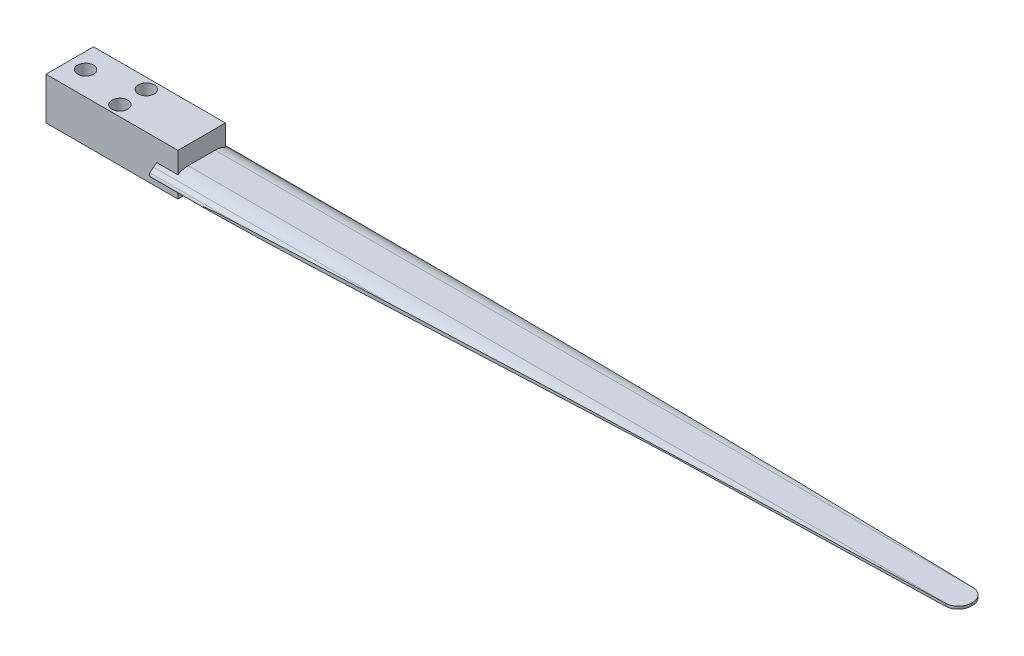
from build123d import *

# Parameters (mm, degrees)
BOSS_EXTRUDE1_DEPTH      = 1500
FILLET1_R                = 40
FILLET2_R                = 40
FILLET3_R                = 5
FILLET4_R                = 5
CUT_EXTRUDE1_DEPTH       = 1502.3316039943886
CUT_EXTRUDE1_DEPTH_BACK  = 1502.3316039943886
FILLET5_R                = 25
BOSS_EXTRUDE2_DEPTH      = 35
BOSS_EXTRUDE2_DEPTH_BACK = 45
SKETCH3_R                = 15.000000000000025
SKETCH3_R_2              = 14.999999999999998


with BuildPart() as part:
    # Sketch1 → Boss-Extrude1 (new body)
    with BuildSketch(Plane(origin=(0, 0, 0), x_dir=(0, 0, -1), z_dir=(1, 0, 0))):
        Polygon((0, 0), (40, 0), (61.94779998780638, -18.416390874921095), (58.733861939373675, -22.246613090515982), (38.18014882866898, -5), (0, -5), (-38.18014882866898, -5), (-58.733861939373675, -22.246613090515982), (-61.94779998780638, -18.416390874921095), (-40, 0), align=None)
    extrude(amount=BOSS_EXTRUDE1_DEPTH)

    # Fillet1
    fillet1_edges = [part.edges().sort_by_distance(p)[0] for p in [
        (750, -5, -38.18014882866898),
        (750, 0, 40),
    ]]
    fillet(fillet1_edges, radius=FILLET1_R)

    # Fillet2
    fillet2_edges = [part.edges().sort_by_distance(p)[0] for p in [
        (750, 0, -40),
    ]]
    fillet(fillet2_edges, radius=FILLET2_R)

    # Fillet3
    # the kernel refuses this fillet: 5 mm, written as the material it takes off along each edge
    with BuildSketch(Plane(origin=(0, -8.840835335933875, -69.98264510888814), x_dir=(0, 0.6427876096865403, 0.7660444431189772), z_dir=(0, -0.7660444431189772, 0.6427876096865403))) as fillet3_piece_1:
        with BuildLine():
            CenterArc((FILLET3_R, -FILLET3_R), FILLET3_R, 90, 90)
            Line((-2.28e-15, -FILLET3_R), (0, 0))
            Line((0, 0), (FILLET3_R, 0))
        make_face()
    extrude(amount=30.000000000000007, mode=Mode.SUBTRACT)
    with BuildSketch(Plane(origin=(-12.500000000000002, -18.4163908749211, -61.94779998780638), x_dir=(0, 0.6427876096865406, 0.7660444431189771), z_dir=(1, 0, 0))) as fillet3_piece_2:
        with BuildLine():
            CenterArc((FILLET3_R, FILLET3_R), FILLET3_R, 180, 90)
            Line((1.03e-15, FILLET3_R), (0, 0))
            Line((0, 0), (FILLET3_R, 2.8e-16))
        make_face()
    extrude(amount=1525, mode=Mode.SUBTRACT)
    with BuildSketch(Plane(origin=(-12.500000000000002, -22.246613090515982, -58.733861939373675), x_dir=(0, 0.7660444431189772, -0.6427876096865403), z_dir=(1, 0, 0))) as fillet3_piece_3:
        with BuildLine():
            CenterArc((FILLET3_R, FILLET3_R), FILLET3_R, 180, 90)
            Line((1.1e-16, FILLET3_R), (0, 0))
            Line((0, 0), (FILLET3_R, -6e-17))
        make_face()
    extrude(amount=1525, mode=Mode.SUBTRACT)
    with BuildSketch(Plane(origin=(1500, -8.840835335933875, -69.98264510888814), x_dir=(0, 0.6427876096865403, 0.7660444431189772), z_dir=(0, -0.7660444431189772, 0.6427876096865403))) as fillet3_piece_4:
        with BuildLine():
            CenterArc((FILLET3_R, FILLET3_R), FILLET3_R, 180, 90)
            Line((-2.28e-15, FILLET3_R), (0, 0))
            Line((0, 0), (FILLET3_R, 0))
        make_face()
    extrude(amount=30.000000000000007, mode=Mode.SUBTRACT)

    # Fillet4
    # the kernel refuses this fillet: 5 mm, written as the material it takes off along each edge
    with BuildSketch(Plane(origin=(0, -31.822168629503203, 50.69901681829192), x_dir=(0, 0.6427876096865403, -0.7660444431189772), z_dir=(0, 0.7660444431189772, 0.6427876096865403))) as fillet4_piece_1:
        with BuildLine():
            CenterArc((FILLET4_R, -FILLET4_R), FILLET4_R, 90, 90)
            Line((0, -FILLET4_R), (0, 0))
            Line((0, 0), (FILLET4_R, 0))
        make_face()
    extrude(amount=30.000000000000007, mode=Mode.SUBTRACT)
    with BuildSketch(Plane(origin=(-12.500000000000007, -22.246613090515982, 58.733861939373675), x_dir=(0, 0.7660444431189776, 0.6427876096865399), z_dir=(1, 0, 0))) as fillet4_piece_2:
        with BuildLine():
            CenterArc((FILLET4_R, -FILLET4_R), FILLET4_R, 90.00000000000004, 90)
            Line((5.38e-15, -FILLET4_R), (0, 0))
            Line((0, 0), (FILLET4_R, 2.4e-16))
        make_face()
    extrude(amount=1525, mode=Mode.SUBTRACT)
    with BuildSketch(Plane(origin=(-12.500000000000002, -18.416390874921095, 61.94779998780638), x_dir=(0, 0.6427876096865403, -0.7660444431189772), z_dir=(1, 0, 0))) as fillet4_piece_3:
        with BuildLine():
            CenterArc((FILLET4_R, -FILLET4_R), FILLET4_R, 90, 89.99999999999997)
            Line((2.28e-15, -FILLET4_R), (0, 0))
            Line((0, 0), (FILLET4_R, 1.1e-16))
        make_face()
    extrude(amount=1525, mode=Mode.SUBTRACT)
    with BuildSketch(Plane(origin=(1500, -31.822168629503203, 50.69901681829192), x_dir=(0, 0.6427876096865403, -0.7660444431189772), z_dir=(0, 0.7660444431189772, 0.6427876096865403))) as fillet4_piece_4:
        with BuildLine():
            CenterArc((FILLET4_R, FILLET4_R), FILLET4_R, 180, 90)
            Line((0, FILLET4_R), (0, 0))
            Line((0, 0), (FILLET4_R, 0))
        make_face()
    extrude(amount=30.000000000000007, mode=Mode.SUBTRACT)

    # Sketch2 → Cut-Extrude1 (cut, two sides: drawn at the far end of the back side and taken through both)
    with BuildSketch(Plane(origin=(0, 0, 0), x_dir=(1, 0, 0), z_dir=(0, 1, 0)).offset(-CUT_EXTRUDE1_DEPTH_BACK)):
        Polygon((1500, -59.90363972377879), (1500, -25.441190629351873), (101.5742667563142, -59.90363972377879), align=None)
        Polygon((1500, 59.90363972377879), (1500, 25.441190629351873), (101.57426675631426, 59.90363972377879), align=None)
    extrude(amount=CUT_EXTRUDE1_DEPTH + CUT_EXTRUDE1_DEPTH_BACK, mode=Mode.SUBTRACT)

    # Fillet5
    fillet5_edges = [part.edges().sort_by_distance(p)[0] for p in [
        (1500, -2.5207098367195613, -25.441190629351873),
        (1500, -2.5, 25.441190629351873),
    ]]
    fillet(fillet5_edges, radius=FILLET5_R)

    # Sketch3 → Boss-Extrude2 (add, two sides: drawn at the far end of the back side and taken through both)
    with BuildSketch(Plane(origin=(0, 0, 0), x_dir=(1, 0, 0), z_dir=(0, 1, 0)).offset(-BOSS_EXTRUDE2_DEPTH_BACK)):
        Polygon((39.99999999999999, 45.00000000000001), (-210, 44.99999999999998), (-210, -45.00000000000002), (40.00000000000001, -44.99999999999998), align=None)
        with Locations(Location((-180, -1.78e-15, 0), (0, 0, 270))):
            Circle(SKETCH3_R, mode=Mode.SUBTRACT)
        with Locations(Location((-90, 25, 0), (0, 0, 270))):
            Circle(SKETCH3_R_2, mode=Mode.SUBTRACT)
        with Locations(Location((-90, -25, 0), (0, 0, 270))):
            Circle(SKETCH3_R_2, mode=Mode.SUBTRACT)
    extrude(amount=BOSS_EXTRUDE2_DEPTH + BOSS_EXTRUDE2_DEPTH_BACK)


solid = part.part
